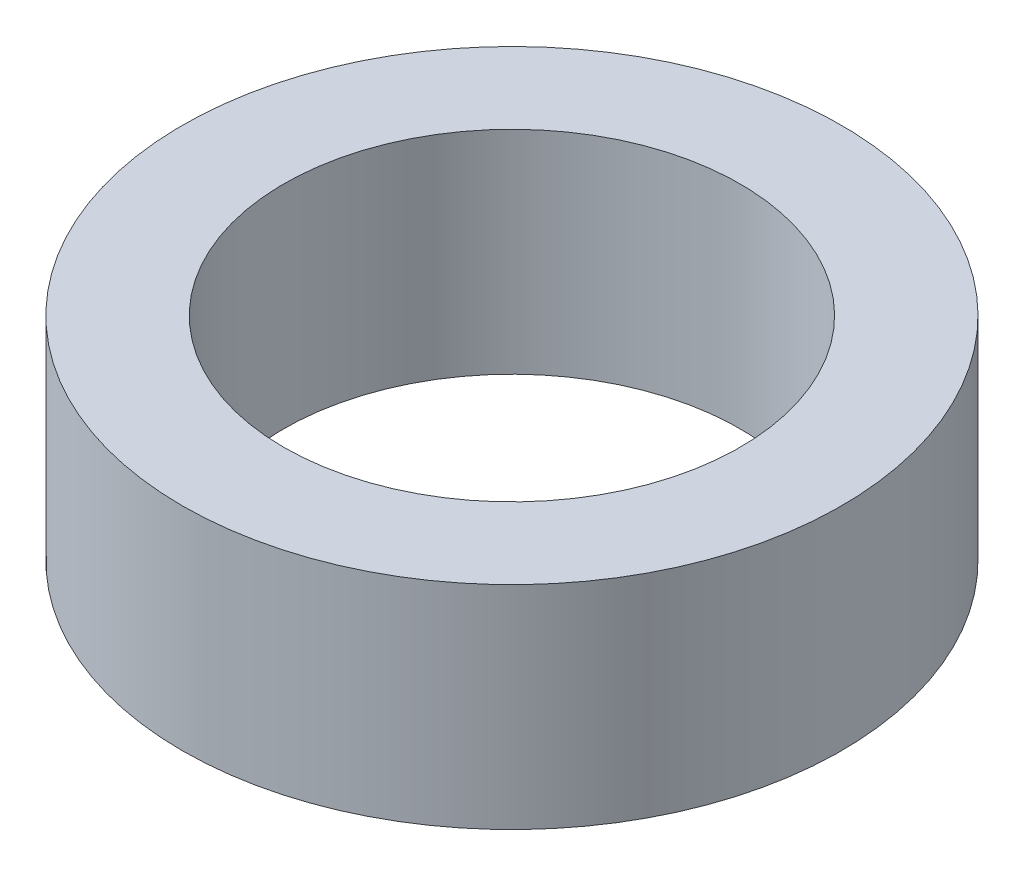
from build123d import *

# Parameters (mm, degrees)
ESQUISSE1_R        = 3.25
ESQUISSE1_R_2      = 2.25
BOSS_EXTRU_1_DEPTH = 2.09175


with BuildPart() as part:
    # Esquisse1 → Boss.-Extru.1 (new body)
    with BuildSketch(Plane(origin=(0, 0, 0), x_dir=(1, 0, 0), z_dir=(0, 1, 0))):
        Circle(ESQUISSE1_R)
        Circle(ESQUISSE1_R_2, mode=Mode.SUBTRACT)
    extrude(amount=BOSS_EXTRU_1_DEPTH)


solid = part.part
